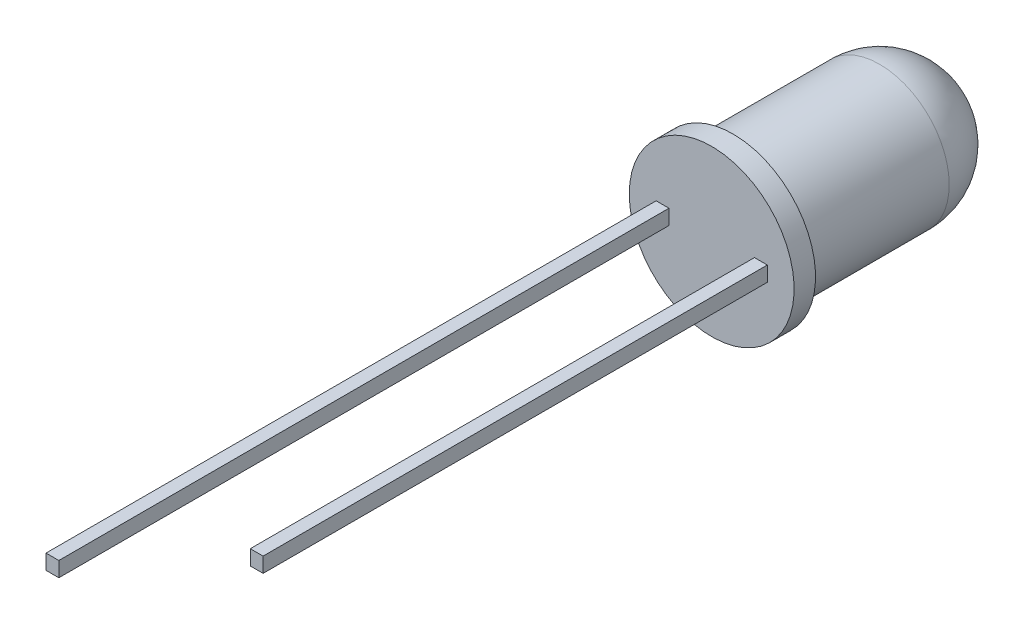
from build123d import *

# Parameters (mm, degrees)
BOSS_EXTRUDE1_DEPTH = 0.35
BOSS_EXTRUDE2_DEPTH = 0.35


with BuildPart() as part:
    # Sketch1 → Boss-Extrude1 (new, symmetric)
    with BuildSketch(Plane(origin=(0, 0, 0), x_dir=(1, 0, 0), z_dir=(0, 1, 0))):
        Polygon((-0.6, 0), (-0.6, 30), (-0.921269942, 30), (-0.921269942, 32), (-0.364499286, 32), (-0.364499286, 31.863365618), (1.498866332, 30), (0, 30), (0, 0), align=None)
    extrude(amount=BOSS_EXTRUDE1_DEPTH, both=True)


with BuildPart() as body_2:
    # Sketch2 → Boss-Extrude2 (new, symmetric)
    with BuildSketch(Plane(origin=(0, 0, 0), x_dir=(1, 0, 0), z_dir=(0, 1, 0))):
        Polygon((0.263788456, 32), (0.263788456, 31.863365618), (2.127154074, 30), (3.993555422, 30), (3.993555422, 4.948502035), (4.593555422, 4.948502035), (4.593555422, 32), align=None)
    extrude(amount=BOSS_EXTRUDE2_DEPTH, both=True)


with BuildPart() as body_3:
    # Sketch3 → Revolve1 (revolve)
    with BuildSketch(Plane(origin=(0, 0, 0), x_dir=(1, 0, 0), z_dir=(0, 1, 0))):
        with BuildLine():
            Line((1.995, 28.5), (5.845, 28.5))
            Line((5.845, 28.5), (5.845, 29.5))
            Line((5.845, 29.5), (5.245, 29.5))
            Line((5.245, 29.5), (5.245, 36.344198407))
            ThreePointArc((5.245, 36.344198407), (4.293097039, 38.642295446), (1.995, 39.594198407))
            Line((1.995, 39.594198407), (1.995, 28.5))
        make_face()
    revolve(axis=Axis((1.995, 0, -38.642405776), (0, 0, 1)))


solid = Compound([part.part, body_2.part, body_3.part])
